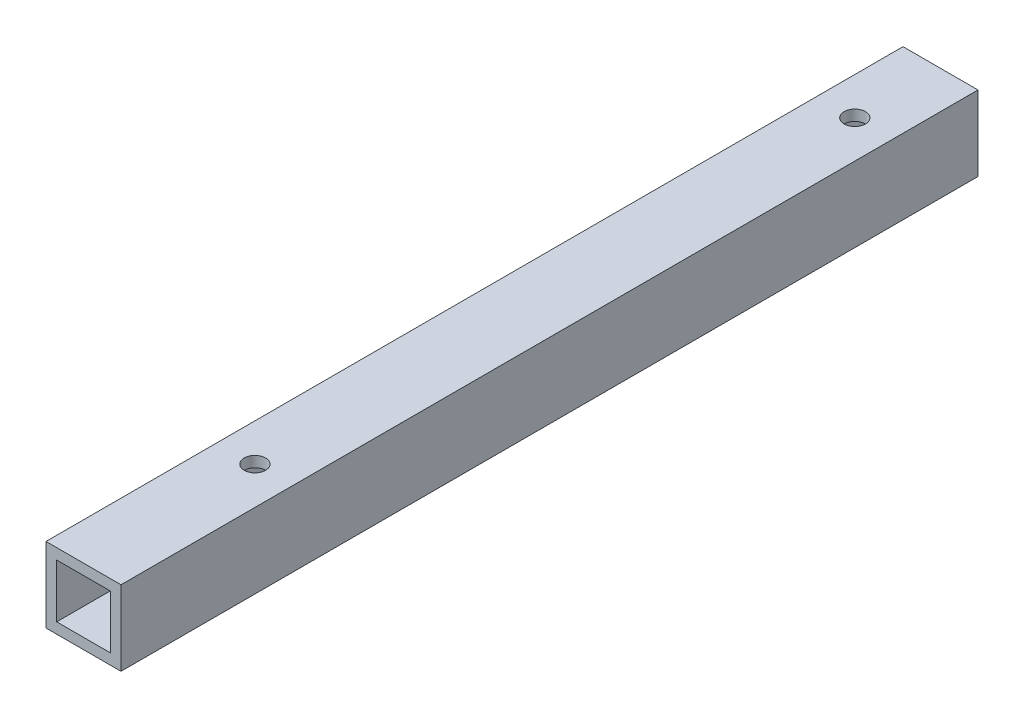
from build123d import *

# Parameters (mm, degrees)
SKETCH1_W           = 22.225
SKETCH1_H           = 22.225
BOSS_EXTRUDE2_DEPTH = 254
SKETCH2_W           = 15.875
SKETCH2_H           = 15.875
CUT_EXTRUDE1_DEPTH  = 256.93729945
SKETCH3_R           = 3.175
CUT_EXTRUDE2_DEPTH  = 256.93729945


with BuildPart() as part:
    # Sketch1 → Boss-Extrude2 (new body)
    with BuildSketch(Plane.XY):
        with Locations((11.1125, 11.1125)):
            Rectangle(SKETCH1_W, SKETCH1_H)
    extrude(amount=BOSS_EXTRUDE2_DEPTH)

    # Sketch2 → Cut-Extrude1 (cut, through all)
    with BuildSketch(Plane(origin=(0, 0, 0), x_dir=(-1, 0, 0), z_dir=(0, 0, -1))):
        with Locations((-11.1125, 11.1125)):
            Rectangle(SKETCH2_W, SKETCH2_H)
    extrude(amount=-CUT_EXTRUDE1_DEPTH, mode=Mode.SUBTRACT)

    # Sketch3 → Cut-Extrude2 (cut, through all)
    with BuildSketch(Plane(origin=(0, 22.225, 0), x_dir=(1, 0, 0), z_dir=(0, 1, 0))):
        with Locations((11.1125, -25.4)):
            Circle(SKETCH3_R)
        with Locations((11.1125, -203.2)):
            Circle(SKETCH3_R)
    extrude(amount=-CUT_EXTRUDE2_DEPTH, mode=Mode.SUBTRACT)


solid = part.part
